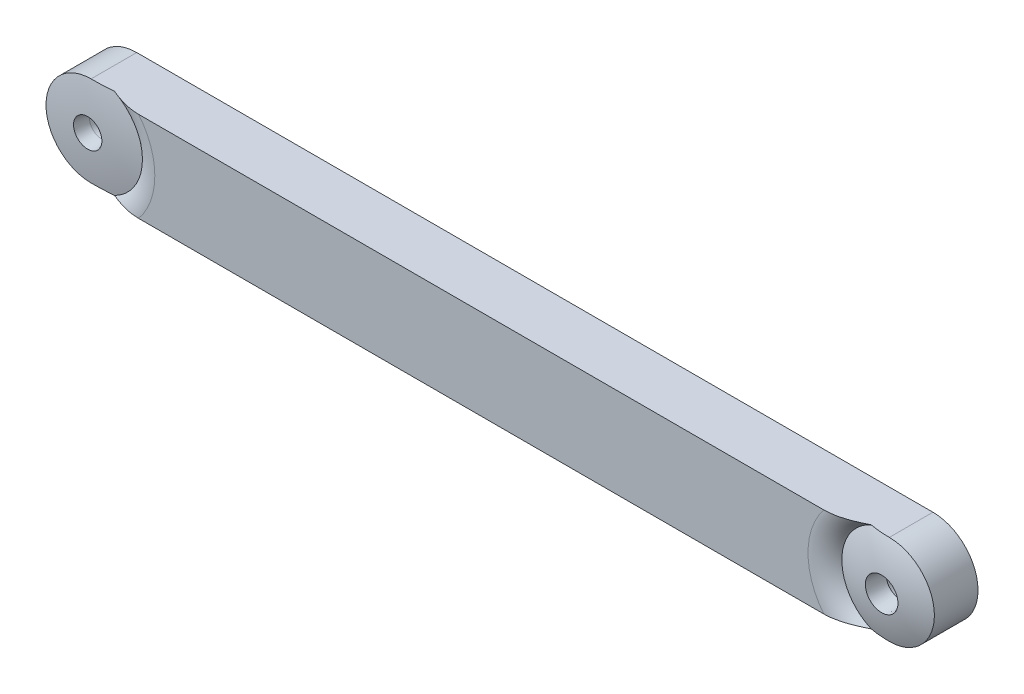
from build123d import *

# Parameters (mm, degrees)
SKETCH_1_R      = 1.55
EXTRUDE_1_DEPTH = 7
FILLET_1_R      = 4


with BuildPart() as part:
    # Эскиз1 → Бобышка-Вытянуть1 (new body)
    with BuildSketch(Plane.XY):
        with BuildLine():
            Line((18.5, 101.493831222), (124.5, 101.493831222))
            ThreePointArc((124.5, 101.493831222), (130.5, 95.493831222), (124.5, 89.493831222))
            Line((124.5, 89.493831222), (18.5, 89.493831222))
            ThreePointArc((18.5, 89.493831222), (12.5, 95.493831222), (18.5, 101.493831222))
        make_face()
        with Locations((124.5, 95.493831222)):
            Circle(SKETCH_1_R, mode=Mode.SUBTRACT)
        with Locations((18.5, 95.493831222)):
            Circle(SKETCH_1_R, mode=Mode.SUBTRACT)
    extrude(amount=EXTRUDE_1_DEPTH)

    # Эскиз3 → Вырез-Повернуть1 (revolve, cut)
    with BuildSketch(Plane(origin=(0, 95.493831222, 0), x_dir=(1, 0, 0), z_dir=(0, 1, 0))):
        with BuildLine():
            Line((11.788259636, -5.953922017), (11.5, -7.498579905))
            Line((11.5, -7.498579905), (18.5, -7.498579905))
            Line((18.5, -7.498579905), (18.5, -3.65512576))
            Line((18.5, -3.65512576), (18.5, 0.188328385))
            Line((18.5, 0.188328385), (15, 0.188328385))
            Line((15, 0.188328385), (15.100959011, -0.893662386))
            ThreePointArc((15.100959011, -0.893662386), (15.858000965, -0.830944257), (16.616181879, -0.783957185))
            Line((16.616181879, -0.783957185), (17.151991145, -3.65512576))
            Line((17.151991145, -3.65512576), (16.616181879, -6.526294335))
            ThreePointArc((16.616181879, -6.526294335), (14.192702827, -6.320391282), (11.788259636, -5.953922017))
        make_face()
    revolve(axis=Axis((18.5, 95.493831222, 14.092750712), (0, 0, -1)), mode=Mode.SUBTRACT)

    # Эскиз4 → Вырез-Повернуть2 (revolve, cut)
    with BuildSketch(Plane(origin=(0, 95.493831222, 0), x_dir=(1, 0, 0), z_dir=(0, 1, 0))):
        with BuildLine():
            Line((124.5, -6.829517276), (124.5, -8.843780512))
            Line((124.5, -8.843780512), (131.5, -8.843780512))
            Line((131.5, -8.843780512), (131.062493989, -5.564992503))
            ThreePointArc((131.062493989, -5.564992503), (128.910766156, -6.355557055), (126.667936093, -6.829517276))
            Line((126.667936093, -6.829517276), (126.340236608, -4.373648978))
            Line((126.340236608, -4.373648978), (126.825045666, -1.111490634))
            ThreePointArc((126.825045666, -1.111490634), (127.546113951, -1.228496574), (128.261402877, -1.37679228))
            Line((128.261402877, -1.37679228), (128.620585304, 1.040056032))
            Line((128.620585304, 1.040056032), (124.5, 1.040056032))
            Line((124.5, 1.040056032), (124.5, -0.95889034))
            Line((124.5, -0.95889034), (124.5, -4.373648978))
            Line((124.5, -4.373648978), (124.5, -6.829517276))
        make_face()
    revolve(axis=Axis((124.5, 95.493831222, 6.829517276), (0, 0, -1)), mode=Mode.SUBTRACT)

    # Скругление1
    # the kernel refuses this fillet: 4 mm, written as the material it takes off along each edge
    with BuildSketch(Plane(origin=(18.5, 95.493831222, 7), x_dir=(-0.3783138091133085, -0.9256774070021258, 0), z_dir=(-0.9256774070021258, 0.3783138091133085, 0))) as fillet_1_piece_1:
        with BuildLine():
            CenterArc((9.408839679, -4), FILLET_1_R, 90, 42.397861789)
            Line((6.711740364, -1.046077983), (6.657798378, -0.986999543))
            ThreePointArc((6.657798378, -0.986999543), (6.730706082, -0.508362986), (6.828314122, 0.014676005))
            Line((6.828314122, 0.014676005), (6.906956445, 0.08))
            Line((6.906956445, 0.08), (9.408839679, 0.08))
            Line((9.408839679, 0.08), (9.408839679, 0))
        make_face()
    revolve(axis=Axis((18.5, 95.493831222, 7), (0, 0, 1)), revolution_arc=224.458550317, mode=Mode.SUBTRACT)
    with BuildSketch(Plane(origin=(124.5, 95.493831222, 7), x_dir=(0.5555728913657687, -0.8314678360462777, 0), z_dir=(0.8314678360462777, 0.5555728913657687, 0))) as fillet_1_piece_2:
        with BuildLine():
            CenterArc((9.631828356, 4), FILLET_1_R, 219.884952178, 50.115047822)
            Line((9.631828356, 0), (9.631828356, -0.08))
            Line((9.631828356, -0.08), (6.753974623, -0.08))
            Line((6.753974623, -0.08), (6.67467745, -0.010581041))
            ThreePointArc((6.67467745, -0.010581041), (6.578937133, 0.706922708), (6.501107302, 1.383707647))
            Line((6.501107302, 1.383707647), (6.562493989, 1.435007497))
        make_face()
    revolve(axis=Axis((124.5, 95.493831222, 7), (0, 0, -1)), revolution_arc=247.500366369, mode=Mode.SUBTRACT)


solid = part.part
